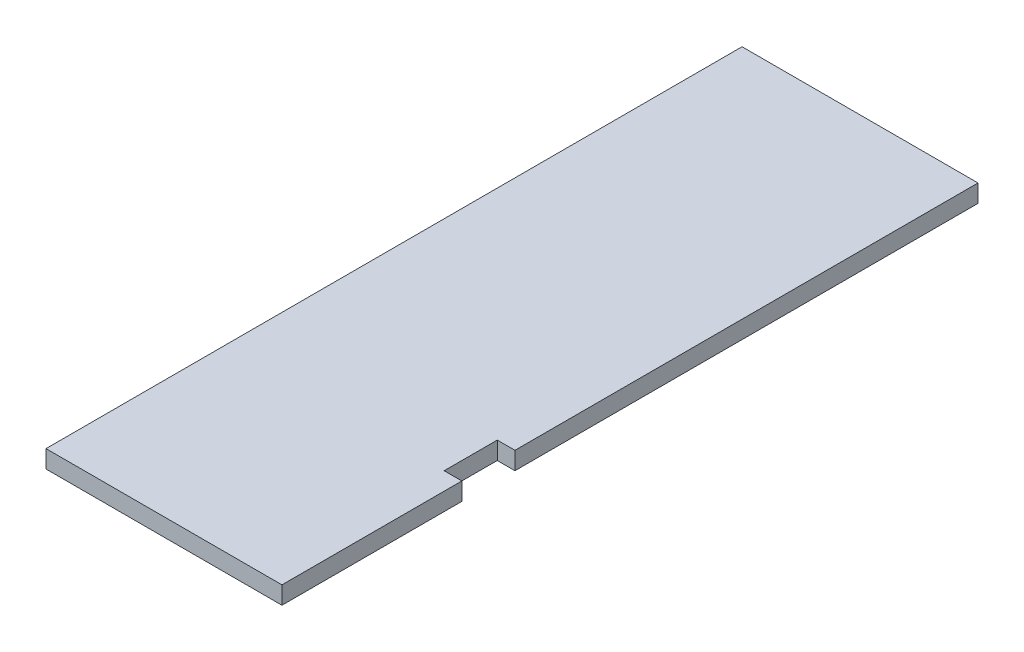
from build123d import *

# Parameters (mm, degrees)
SKETCH1_W           = 40
SKETCH1_H           = 98
BOSS_EXTRUDE1_DEPTH = 3
SKETCH4_W           = 40
SKETCH4_H           = 3
BOSS_EXTRUDE3_DEPTH = 20
SKETCH9_W           = 3
SKETCH9_H           = 9
CUT_EXTRUDE1_DEPTH  = 10


with BuildPart() as part:
    # Sketch1 → Boss-Extrude1 (new body)
    with BuildSketch(Plane(origin=(0, 0, 0), x_dir=(1, 0, 0), z_dir=(0, 1, 0))):
        with Locations((20, 49)):
            Rectangle(SKETCH1_W, SKETCH1_H)
    extrude(amount=BOSS_EXTRUDE1_DEPTH)

    # Sketch4 → Boss-Extrude3 (add)
    with BuildSketch(Plane.XY):
        with Locations((20, 1.5)):
            Rectangle(SKETCH4_W, SKETCH4_H)
    extrude(amount=BOSS_EXTRUDE3_DEPTH)

    # Sketch9 → Cut-Extrude1 (cut)
    with BuildSketch(Plane(origin=(0, 3, 0), x_dir=(1, 0, 0), z_dir=(0, 1, 0))):
        with Locations((38.5, 15)):
            Rectangle(SKETCH9_W, SKETCH9_H)
    extrude(amount=-CUT_EXTRUDE1_DEPTH, mode=Mode.SUBTRACT)


solid = part.part
